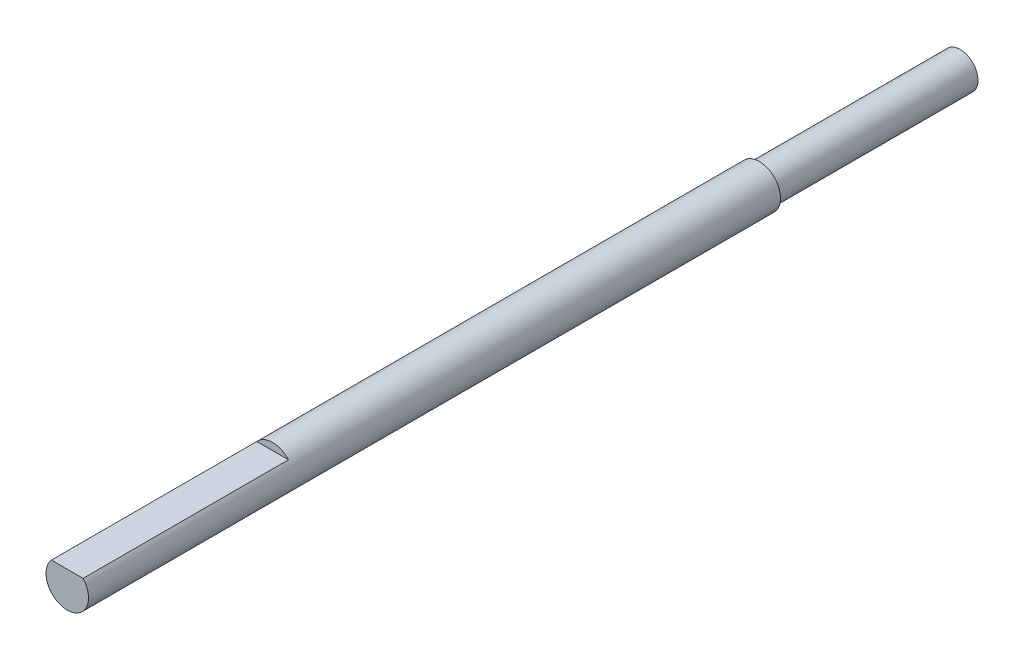
from build123d import *

# Parameters (mm, degrees)
SKETCH1_R           = 4.7625
BOSS_EXTRUDE1_DEPTH = 200
CUT_EXTRUDE1_START  = -46
CUT_EXTRUDE1_DEPTH  = 46
SKETCH3_R           = 4.7625
SKETCH3_R_2         = 4
CUT_EXTRUDE2_DEPTH  = 45


with BuildPart() as part:
    # Sketch1 → Boss-Extrude1 (new body)
    with BuildSketch(Plane.XY):
        Circle(SKETCH1_R)
    extrude(amount=BOSS_EXTRUDE1_DEPTH)

    # Sketch2 → Cut-Extrude1 (cut)
    with BuildSketch(Plane.XY.offset(200).offset(CUT_EXTRUDE1_START)):
        with BuildLine():
            ThreePointArc((3.549757914, 3.175), (0, 4.7625), (-3.549757914, 3.175))
            Line((-3.549757914, 3.175), (3.549757914, 3.175))
        make_face()
    extrude(amount=CUT_EXTRUDE1_DEPTH, mode=Mode.SUBTRACT)

    # Sketch3 → Cut-Extrude2 (cut)
    with BuildSketch(Plane(origin=(0, 0, 0), x_dir=(-1, 0, 0), z_dir=(0, 0, -1))):
        Circle(SKETCH3_R)
        Circle(SKETCH3_R_2, mode=Mode.SUBTRACT)
    extrude(amount=-CUT_EXTRUDE2_DEPTH, mode=Mode.SUBTRACT)


solid = part.part
